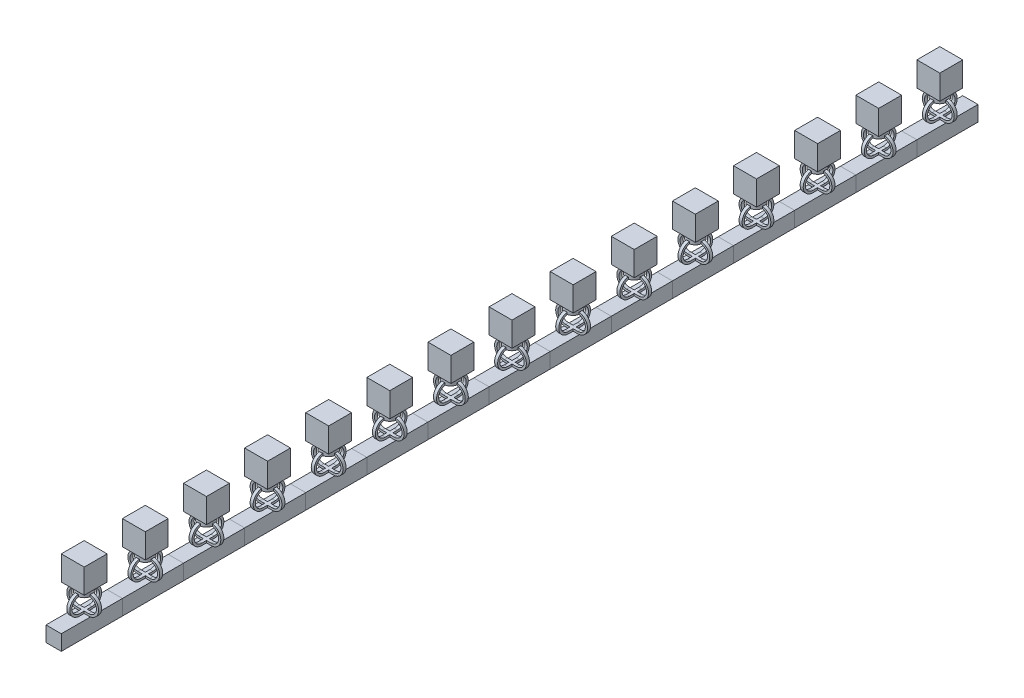
from build123d import *

# Parameters (mm, degrees)
SKETCH1_W           = 5
SKETCH1_H           = 5
BOSS_EXTRUDE1_DEPTH = 10
BOSS_EXTRUDE2_DEPTH = 0.5
BOSS_EXTRUDE3_DEPTH = 0.5
SKETCH4_W           = 7.5
SKETCH4_H           = 7.5
BOSS_EXTRUDE4_DEPTH = 10
CHAMFER1_SIZE       = 2
BOSS_EXTRUDE5_REACH = 17.541
SKETCH5_R           = 2.474873734
LPATTERN2_COUNT     = 15
LPATTERN2_PITCH     = 20


with BuildPart() as part:
    # Sketch1 → Boss-Extrude1 (new, symmetric)
    with BuildSketch(Plane.XY):
        Rectangle(SKETCH1_W, SKETCH1_H)
    extrude(amount=BOSS_EXTRUDE1_DEPTH, both=True)

    # Sketch2 → Boss-Extrude2 (add, symmetric)
    with BuildSketch(Plane.XY):
        with BuildLine():
            Line((0, 3.2), (-2, 3.2))
            ThreePointArc((-2, 3.2), (-4.5, 5.7), (-2, 8.2))
            Line((-2, 8.2), (0, 8.2))
            Line((0, 8.2), (0, 8.9))
            Line((0, 8.9), (-2, 8.9))
            ThreePointArc((-2, 8.9), (-5.2, 5.7), (-2, 2.5))
            Line((-2, 2.5), (0, 2.5))
            Line((0, 2.5), (0, 3.2))
        make_face()
    boss_extrude2 = extrude(amount=BOSS_EXTRUDE2_DEPTH, both=True)

    # Mirror1: Boss-Extrude2 across plane
    add(boss_extrude2.mirror(Plane(origin=(0, 0, 0), x_dir=(0, 0, 1), z_dir=(1, 0, 0))))

    # Sketch3 → Boss-Extrude3 (add, symmetric)
    with BuildSketch(Plane(origin=(0, 0, 0), x_dir=(0, 0, -1), z_dir=(1, 0, 0))):
        with BuildLine():
            Line((0, 2.5), (-2, 2.5))
            ThreePointArc((-2, 2.5), (-5.2, 5.7), (-2, 8.9))
            Line((-2, 8.9), (0, 8.9))
            Line((0, 8.9), (0, 8.2))
            Line((0, 8.2), (-2, 8.2))
            ThreePointArc((-2, 8.2), (-4.5, 5.7), (-2, 3.2))
            Line((-2, 3.2), (0, 3.2))
            Line((0, 3.2), (0, 2.5))
        make_face()
    boss_extrude3 = extrude(amount=BOSS_EXTRUDE3_DEPTH, both=True)

    # Mirror2: Boss-Extrude3 across plane
    add(boss_extrude3.mirror(Plane.XY))


with BuildPart() as body_2:
    # Sketch4 → Boss-Extrude4 (new body)
    with BuildSketch(Plane(origin=(0, 8.9, 0), x_dir=(1, 0, 0), z_dir=(0, 1, 0))):
        Rectangle(SKETCH4_W, SKETCH4_H)
    extrude(amount=BOSS_EXTRUDE4_DEPTH)

    # Chamfer1
    chamfer1_edges = [body_2.edges().sort_by_distance(p)[0] for p in [
        (3.75, 8.9, 0),
        (0, 8.9, 3.75),
        (-3.75, 8.9, 0),
        (0, 8.9, -3.75),
    ]]
    chamfer(chamfer1_edges, length=CHAMFER1_SIZE)

    # Sketch5 → Boss-Extrude5 (add, up to next)
    with BuildSketch(Plane.XZ.offset(-8.2), mode=Mode.PRIVATE) as boss_extrude5_sk1:
        Circle(SKETCH5_R)
    boss_extrude5_tool1 = extrude(boss_extrude5_sk1.sketch, amount=-BOSS_EXTRUDE5_REACH, mode=Mode.PRIVATE) - body_2.part

    add(part.part)  # Boss-Extrude5 merges part
    add(boss_extrude5_tool1.solids().sort_by_distance((0, 8.2, 0))[0])


with BuildPart() as lpattern2_1:
    # LPattern2: pattern copy
    add(body_2.part.moved(Location(Vector(0, 0, 1) * (1 * LPATTERN2_PITCH))))


with BuildPart() as lpattern2_2:
    # LPattern2: pattern copy
    add(body_2.part.moved(Location(Vector(0, 0, 1) * (2 * LPATTERN2_PITCH))))


with BuildPart() as lpattern2_3:
    # LPattern2: pattern copy
    add(body_2.part.moved(Location(Vector(0, 0, 1) * (3 * LPATTERN2_PITCH))))


with BuildPart() as lpattern2_4:
    # LPattern2: pattern copy
    add(body_2.part.moved(Location(Vector(0, 0, 1) * (4 * LPATTERN2_PITCH))))


with BuildPart() as lpattern2_5:
    # LPattern2: pattern copy
    add(body_2.part.moved(Location(Vector(0, 0, 1) * (5 * LPATTERN2_PITCH))))


with BuildPart() as lpattern2_6:
    # LPattern2: pattern copy
    add(body_2.part.moved(Location(Vector(0, 0, 1) * (6 * LPATTERN2_PITCH))))


with BuildPart() as lpattern2_7:
    # LPattern2: pattern copy
    add(body_2.part.moved(Location(Vector(0, 0, 1) * (7 * LPATTERN2_PITCH))))


with BuildPart() as lpattern2_8:
    # LPattern2: pattern copy
    add(body_2.part.moved(Location(Vector(0, 0, 1) * (8 * LPATTERN2_PITCH))))


with BuildPart() as lpattern2_9:
    # LPattern2: pattern copy
    add(body_2.part.moved(Location(Vector(0, 0, 1) * (9 * LPATTERN2_PITCH))))


with BuildPart() as lpattern2_10:
    # LPattern2: pattern copy
    add(body_2.part.moved(Location(Vector(0, 0, 1) * (10 * LPATTERN2_PITCH))))


with BuildPart() as lpattern2_11:
    # LPattern2: pattern copy
    add(body_2.part.moved(Location(Vector(0, 0, 1) * (11 * LPATTERN2_PITCH))))


with BuildPart() as lpattern2_12:
    # LPattern2: pattern copy
    add(body_2.part.moved(Location(Vector(0, 0, 1) * (12 * LPATTERN2_PITCH))))


with BuildPart() as lpattern2_13:
    # LPattern2: pattern copy
    add(body_2.part.moved(Location(Vector(0, 0, 1) * (13 * LPATTERN2_PITCH))))


with BuildPart() as lpattern2_14:
    # LPattern2: pattern copy
    add(body_2.part.moved(Location(Vector(0, 0, 1) * (14 * LPATTERN2_PITCH))))


solid = Compound([body_2.part, lpattern2_1.part, lpattern2_2.part, lpattern2_3.part, lpattern2_4.part, lpattern2_5.part, lpattern2_6.part, lpattern2_7.part, lpattern2_8.part, lpattern2_9.part, lpattern2_10.part, lpattern2_11.part, lpattern2_12.part, lpattern2_13.part, lpattern2_14.part])
